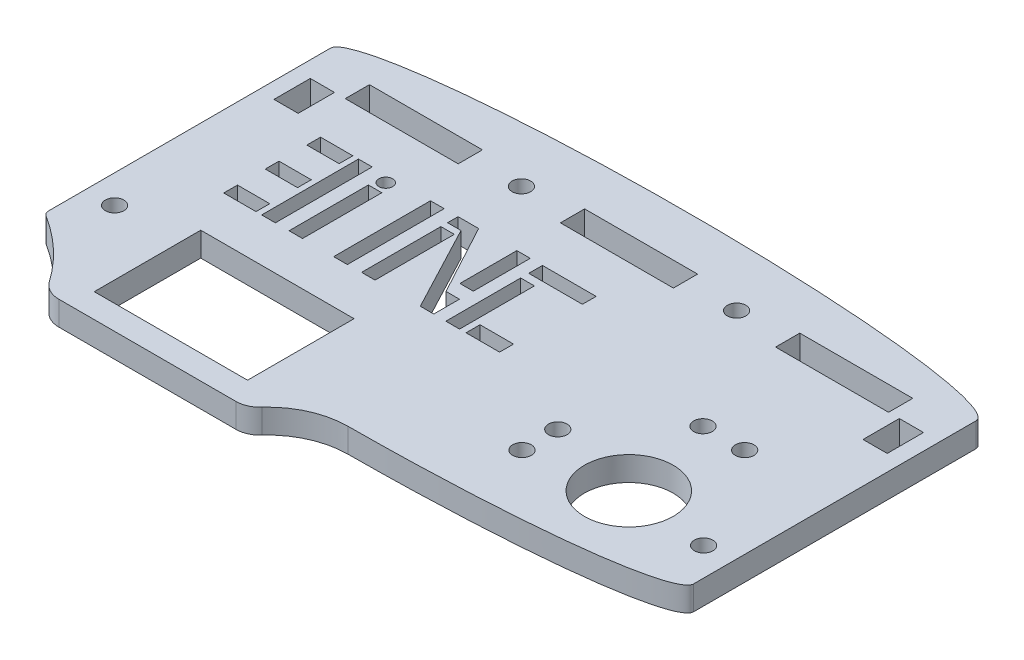
from build123d import *

# Parameters (mm, degrees)
SKETCH1_W           = 80
SKETCH1_H           = 35
BOSS_EXTRUDE1_DEPTH = 1.5
SKETCH2_R           = 1.15
SKETCH2_W           = 14
SKETCH2_H           = 3
CUT_EXTRUDE1_DEPTH  = 44.763569324
BOSS_EXTRUDE2_DEPTH = 3
SKETCH7_R           = 1.15
SKETCH7_W           = 3
SKETCH7_H           = 4.5
CUT_EXTRUDE3_DEPTH  = 46.749317077
BOSS_EXTRUDE3_DEPTH = 3
BOSS_EXTRUDE4_DEPTH = 3
CUT_EXTRUDE4_DEPTH  = 10
FILLET1_START       = -1.5
FILLET1_DEPTH       = 3
FILLET2_START       = -1.5
FILLET2_DEPTH       = 3
FILLET3_R           = 3
SKETCH14_W          = 4
SKETCH14_H          = 1.7
SKETCH14_W_2        = 1.7
SKETCH14_H_2        = 12
SKETCH14_W_3        = 1.668725188
SKETCH14_H_3        = 9.826400532
SKETCH14_H_4        = 9.826400533
SKETCH14_W_4        = 1.660704434
SKETCH14_H_5        = 7.055688022
SKETCH14_H_6        = 9.27636253
SKETCH14_W_5        = 6.651137072
SKETCH14_W_6        = 4.152790203
SKETCH14_H_7        = 1.727010254
SKETCH14_R          = 0.85
CUT_EXTRUDE7_DEPTH  = 10
SKETCH16_R          = 5.5
CUT_EXTRUDE8_DEPTH  = 10
SKETCH17_R          = 1.15
CUT_EXTRUDE9_DEPTH  = 10


with BuildPart() as part:
    # Sketch1 → Boss-Extrude1 (new, symmetric)
    with BuildSketch(Plane(origin=(0, 0, 0), x_dir=(1, 0, 0), z_dir=(0, 1, 0))):
        Rectangle(SKETCH1_W, SKETCH1_H)
    extrude(amount=BOSS_EXTRUDE1_DEPTH, both=True)

    # Sketch2 → Cut-Extrude1 (cut, through all)
    with BuildSketch(Plane(origin=(0, 1.5, 0), x_dir=(1, 0, 0), z_dir=(0, 1, 0))):
        with Locations(Location((-13.333333333, 14.5, 0), (0, 0, 270))):
            Circle(SKETCH2_R)
        with Locations(Location((13.333333333, 14.5, 0), (0, 0, 270))):
            Circle(SKETCH2_R)
        with Locations((-26.666666667, 14.5)):
            Rectangle(SKETCH2_W, SKETCH2_H)
        with Locations((0, 14.5)):
            Rectangle(SKETCH2_W, SKETCH2_H)
        with Locations((26.666666667, 14.5)):
            Rectangle(SKETCH2_W, SKETCH2_H)
    extrude(amount=-CUT_EXTRUDE1_DEPTH, mode=Mode.SUBTRACT)

    # Sketch3 → Boss-Extrude2 (add)
    with BuildSketch(Plane(origin=(0, 1.5, 0), x_dir=(1, 0, 0), z_dir=(0, 1, 0))):
        with BuildLine():
            Line((40, 17.5), (-40, 17.5))
            add(Edge.make_bspline(
                [(40, 17.5), (40, 22), (0, 22), (-40, 22), (-40, 17.5)],
                knots=[3.141592654, 3.141592654, 3.141592654, 4.71238898, 4.71238898, 6.283185307, 6.283185307, 6.283185307], degree=2, weights=[1, 0.707106781, 1, 0.707106781, 1]))
        make_face()
    extrude(amount=-BOSS_EXTRUDE2_DEPTH)

    # Sketch7 → Cut-Extrude3 (cut, through all)
    with BuildSketch(Plane.XZ.offset(1.5)):
        with Locations(Location((-36.5, 12.75, 0), (0, 0, 270))):
            Circle(SKETCH7_R)
        with Locations(Location((36.5, 12.75, 0), (0, 0, 270))):
            Circle(SKETCH7_R)
        with Locations((36.5, -10.75)):
            Rectangle(SKETCH7_W, SKETCH7_H)
        with Locations((-36.5, -10.75)):
            Rectangle(SKETCH7_W, SKETCH7_H)
    extrude(amount=-CUT_EXTRUDE3_DEPTH, mode=Mode.SUBTRACT)

    # Sketch8 → Boss-Extrude3 (add)
    with BuildSketch(Plane.XZ.offset(1.5)):
        with BuildLine():
            Line((-40, 17.5), (40, 17.5))
            add(Edge.make_bspline(
                [(40, 17.5), (40, 22), (0, 22), (-40, 22), (-40, 17.5)],
                knots=[0, 0, 0, 1.570796327, 1.570796327, 3.141592654, 3.141592654, 3.141592654], degree=2, weights=[1, 0.707106781, 1, 0.707106781, 1]))
        make_face()
    extrude(amount=-BOSS_EXTRUDE3_DEPTH)

    # Sketch10 → Boss-Extrude4 (add)
    with BuildSketch(Plane(origin=(0, 1.5, 0), x_dir=(1, 0, 0), z_dir=(0, 1, 0))):
        with BuildLine():
            add(Edge.make_bspline(
                [(-31.5, -20.273415933), (-30.097145276, -20.475072928), (-28.5, -20.657524495)],
                knots=[3.805646931, 3.805646931, 3.805646931, 3.920888088, 3.920888088, 3.920888088], degree=2, weights=[1, 0.989412299, 0.982106666]))
            Line((-31.5, -20.273415933), (-31.5, -26.273415933))
            Line((-31.5, -26.273415933), (-6.5, -26.273415933))
            Line((-6.5, -26.273415933), (-6.5, -21.940188446))
            add(Edge.make_bspline(
                [(-9.5, -21.871243923), (-8.01173666, -21.912179734), (-6.5, -21.940188446)],
                knots=[4.471327399, 4.471327399, 4.471327399, 4.549165177, 4.549165177, 4.549165177], degree=2, weights=[0.987194732, 0.992848708, 1]))
            Line((-9.5, -21.871243923), (-9.5, -23.273415933))
            Line((-9.5, -23.273415933), (-28.5, -23.273415933))
            Line((-28.5, -23.273415933), (-28.5, -20.657524495))
        make_face()
        with BuildLine():
            add(Edge.make_bspline(
                [(-28.5, -20.657524495), (-20.531503418, -21.567814066), (-9.5, -21.871243923)],
                knots=[3.920888088, 3.920888088, 3.920888088, 4.471327399, 4.471327399, 4.471327399], degree=2, weights=[0.982106666, 0.94721195, 0.987194732]))
            Line((-28.5, -20.657524495), (-28.5, -23.273415933))
            Line((-28.5, -23.273415933), (-9.5, -23.273415933))
            Line((-9.5, -23.273415933), (-9.5, -21.871243923))
        make_face()
    extrude(amount=-BOSS_EXTRUDE4_DEPTH)

    # Sketch10<3> → Cut-Extrude4 (cut)
    with BuildSketch(Plane(origin=(0, 1.5, 0), x_dir=(1, 0, 0), z_dir=(0, 1, 0))):
        with BuildLine():
            Line((-28.5, -10.073415933), (-28.5, -20.657524495))
            add(Edge.make_bspline(
                [(-28.5, -20.657524495), (-20.531503418, -21.567814066), (-9.5, -21.871243923)],
                knots=[3.920888088, 3.920888088, 3.920888088, 4.471327399, 4.471327399, 4.471327399], degree=2, weights=[0.982106666, 0.94721195, 0.987194732]))
            Line((-9.5, -21.871243923), (-9.5, -10.073415933))
            Line((-9.5, -10.073415933), (-28.5, -10.073415933))
        make_face()
        with BuildLine():
            add(Edge.make_bspline(
                [(-28.5, -20.657524495), (-20.531503418, -21.567814066), (-9.5, -21.871243923)],
                knots=[3.920888088, 3.920888088, 3.920888088, 4.471327399, 4.471327399, 4.471327399], degree=2, weights=[0.982106666, 0.94721195, 0.987194732]))
            Line((-28.5, -20.657524495), (-28.5, -23.273415933))
            Line((-28.5, -23.273415933), (-9.5, -23.273415933))
            Line((-9.5, -23.273415933), (-9.5, -21.871243923))
        make_face()
    extrude(amount=-CUT_EXTRUDE4_DEPTH, mode=Mode.SUBTRACT)

    # Fillet1: read off the stored shape, not the designer's step
    # Fillet1 outline → Fillet1 (add)
    with BuildSketch(Plane(origin=(0, 0, 0), x_dir=(1, 0, 0), z_dir=(0, 1, 0)).offset(FILLET1_START)):
        with BuildLine():
            add(Edge.make_bspline(
                [(-31.5, -20.273415933), (-37.645057381, -19.390078703), (-39.385725394, -18.285606399)],
                knots=[2.477538376, 2.477538376, 2.477538376, 2.964990982, 2.964990982, 2.964990982], degree=2, weights=[1, 0.95990848, 0.978675751]))
            ThreePointArc((-39.385725394, -18.285606399), (-34.988771161, -21.831222917), (-31.5, -26.273415933))
            Line((-31.5, -26.273415933), (-31.5, -20.273415933))
        make_face()
    extrude(amount=FILLET1_DEPTH)

    # Fillet2: read off the stored shape, not the designer's step
    # Fillet2 outline → Fillet2 (add)
    with BuildSketch(Plane(origin=(0, 0, 0), x_dir=(1, 0, 0), z_dir=(0, 1, 0)).offset(FILLET2_START)):
        with BuildLine():
            Line((-6.5, -21.940188446), (-6.5, -26.273415933))
            ThreePointArc((-6.5, -26.273415933), (-2.944519169, -23.140428139), (1.654142088, -21.996150592))
            add(Edge.make_bspline(
                [(1.654142088, -21.996150592), (-2.448460848, -22.015253368), (-6.5, -21.940188446)],
                knots=[1.511133725, 1.511133725, 1.511133725, 1.73402013, 1.73402013, 1.73402013], degree=2, weights=[0.920941451, 0.954640309, 1]))
        make_face()
    extrude(amount=FILLET2_DEPTH)

    # Fillet3
    fillet3_edges = [part.edges().sort_by_distance(p)[0] for p in [
        (-6.5, 0, 26.273415933),
        (-31.5, 0, 26.273415933),
    ]]
    fillet(fillet3_edges, radius=FILLET3_R)

    # Sketch14 → Cut-Extrude7 (cut)
    with BuildSketch(Plane(origin=(0, 1.5, 0), x_dir=(1, 0, 0), z_dir=(0, 1, 0))):
        with Locations((-29.062394578, 6.486978484)):
            Rectangle(SKETCH14_W, SKETCH14_H)
        with Locations((-29.063618633, 1.336098822)):
            Rectangle(SKETCH14_W, SKETCH14_H)
        with Locations((-29.067615847, -3.805920652)):
            Rectangle(SKETCH14_W, SKETCH14_H)
        with Locations((-25.512215822, 1.336978484)):
            Rectangle(SKETCH14_W_2, SKETCH14_H_2)
        with Locations((-22.13113135, 0.251784263)):
            Rectangle(SKETCH14_W_3, SKETCH14_H_3)
        with Locations((-16.574222024, 1.322372137)):
            Rectangle(SKETCH14_W_2, SKETCH14_H_2)
        with Locations((-13.173507527, 0.279752512)):
            Rectangle(SKETCH14_W_3, SKETCH14_H_4)
        Polygon((-5.060980263, -1.449564322), (-5.060980263, -4.633447754), (-6.72970545, -4.633447754), (-12.339144933, 6.019294619), (-14.007870121, 6.019294619), (-14.007870121, 7.322372137), (-11.457259089, 7.322372137), (-6.72970545, -1.449564322), align=None)
        with Locations((-5.89133248, 3.794528126)):
            Rectangle(SKETCH14_W_4, SKETCH14_H_5)
        with Locations((-2.695314118, -0.017246316)):
            Rectangle(SKETCH14_W_2, SKETCH14_H_6)
        with Locations((-0.219745582, 6.468683245)):
            Rectangle(SKETCH14_W_5, SKETCH14_H)
        with Locations((1.029427853, -3.781554291)):
            Rectangle(SKETCH14_W_6, SKETCH14_H_7)
        with Locations(Location((-22.13113135, 6.486978484, 0), (0, 0, 270))):
            Circle(SKETCH14_R)
    extrude(amount=-CUT_EXTRUDE7_DEPTH, mode=Mode.SUBTRACT)

    # Sketch16 → Cut-Extrude8 (cut)
    with BuildSketch(Plane(origin=(0, 1.5, 0), x_dir=(1, 0, 0), z_dir=(0, 1, 0))):
        with Locations(Location((25.996749722, -11.519319406, 0), (0, 0, 270))):
            Circle(SKETCH16_R)
    extrude(amount=-CUT_EXTRUDE8_DEPTH, mode=Mode.SUBTRACT)

    # Sketch17 → Cut-Extrude9 (cut)
    with BuildSketch(Plane(origin=(0, 1.5, 0), x_dir=(1, 0, 0), z_dir=(0, 1, 0))):
        with Locations(Location((15.007821115, -13.770621572, 0), (0, 0, 270))):
            Circle(SKETCH17_R)
        with Locations(Location((23.662541349, 0, 0), (0, 0, 270))):
            Circle(SKETCH17_R)
        with Locations(Location((28.809754119, 0.025288398, 0), (0, 0, 270))):
            Circle(SKETCH17_R)
        with Locations(Location((15.00136178, -9.329102627, 0), (0, 0, 270))):
            Circle(SKETCH17_R)
    extrude(amount=-CUT_EXTRUDE9_DEPTH, mode=Mode.SUBTRACT)


solid = part.part
